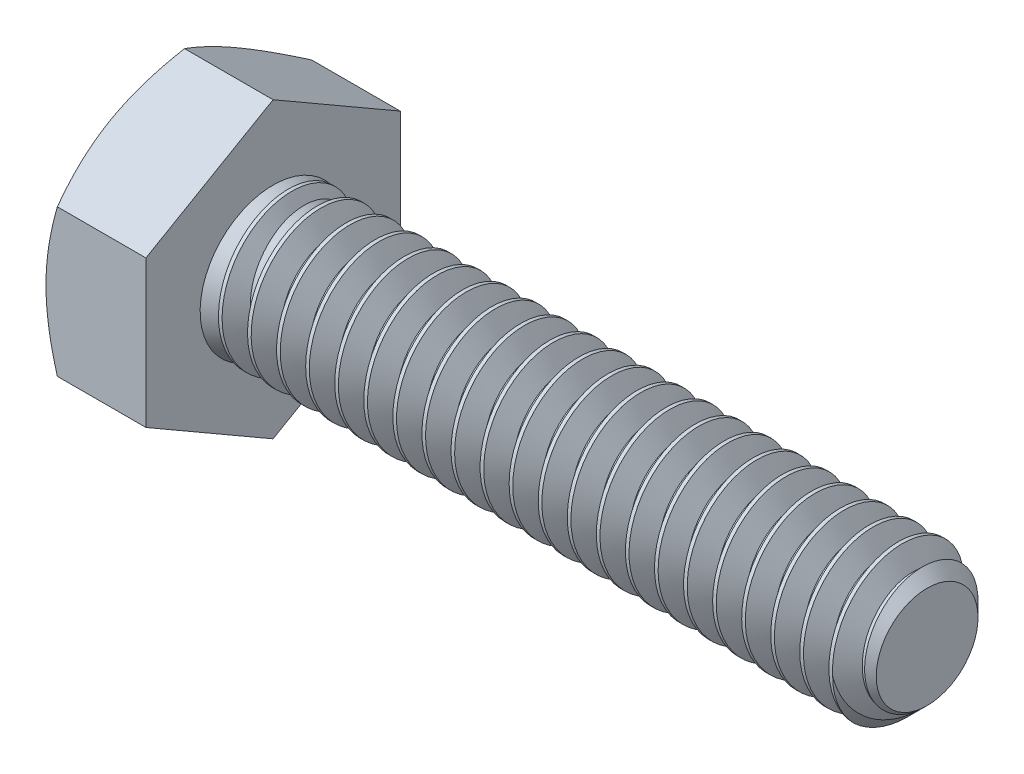
from build123d import *

# Parameters (mm, degrees)
BOSS_EXTRUDE4_DEPTH = 4.365625
SKETCH5_R           = 3.175
BOSS_EXTRUDE3_DEPTH = 28.575
SKETCH8_OUTSIDE_W   = 141.824
SKETCH8_OUTSIDE_H   = 143.544
SKETCH8_OUTSIDE_R   = 5.55625
CUT_EXTRUDE3_DEPTH  = 35.016455452
CUT_EXTRUDE3_DRAFT  = -60
CUT_EXTRUDE4_DEPTH  = 0.254
CIRPATTERN1_COUNT   = 6
CHAMFER1_SIZE       = 0.9525
CUT_SWEEP2_PITCH    = 1.27
CUT_SWEEP2_TO       = 28.575


with BuildPart() as part:
    # Sketch6 → Boss-Extrude4 (new body)
    with BuildSketch(Plane.ZY.offset(12.1046875)):
        Polygon((5.55625, 3.207902433), (0, 6.415804866), (-5.55625, 3.207902433), (-5.55625, -3.207902433), (0, -6.415804866), (5.55625, -3.207902433), align=None)
    extrude(amount=BOSS_EXTRUDE4_DEPTH)

    # Sketch5 → Boss-Extrude3 (add)
    with BuildSketch(Plane(origin=(16.4703125, 0, 0), x_dir=(0, 0, -1), z_dir=(1, 0, 0))):
        Circle(SKETCH5_R)
    extrude(amount=-BOSS_EXTRUDE3_DEPTH)


with BuildPart() as cut_extrude3_tool:
    # Sketch8 outside → Cut-Extrude3 (with draft: the straight prism first)
    with BuildSketch(Plane.ZY.offset(16.4703125)):
        Rectangle(SKETCH8_OUTSIDE_W, SKETCH8_OUTSIDE_H)
        Circle(SKETCH8_OUTSIDE_R, mode=Mode.SUBTRACT)
    extrude(amount=-CUT_EXTRUDE3_DEPTH)
    # Cut-Extrude3: the draft: its side faces are tilted about the plane it starts from
    cut_extrude3_sides = [cut_extrude3_tool.faces().sort_by_distance(p)[0] for p in [
        (1.037915226, -71.772, 0),
        (1.037915226, 0, 70.912),
        (1.037915226, 71.772, 0),
        (1.037915226, 0, -70.912),
        (1.037915226, 0, -5.55625),
    ]]
    draft(cut_extrude3_sides, Plane.ZY.offset(16.4703125), CUT_EXTRUDE3_DRAFT)


with BuildPart() as part_1:
    add(part.part)

    # Cut-Extrude3: cut by cut_extrude3_tool
    add(cut_extrude3_tool.part, mode=Mode.SUBTRACT)

    # Sketch12 → Cut-Extrude4 (cut)
    with BuildSketch(Plane.ZY.offset(16.4703125)):
        with BuildLine():
            Line((0.1666875, 4.2783125), (0.1666875, 2.3891875))
            ThreePointArc((0.1666875, 2.3891875), (0, 2.2225), (-0.1666875, 2.3891875))
            Line((-0.1666875, 2.3891875), (-0.1666875, 4.2783125))
            ThreePointArc((-0.1666875, 4.2783125), (0, 4.445), (0.1666875, 4.2783125))
        make_face()
    cut_extrude4 = extrude(amount=-CUT_EXTRUDE4_DEPTH, mode=Mode.SUBTRACT)

    # CirPattern1: Cut-Extrude4 ×6 about axis
    cirpattern1_axis = Axis((0, 0, 0), (1, 0, 0))
    for i in range(1, CIRPATTERN1_COUNT):
        add(cut_extrude4.rotate(cirpattern1_axis, i * 360 / CIRPATTERN1_COUNT), mode=Mode.SUBTRACT)

    # Chamfer1
    chamfer1_edges = [part_1.edges().sort_by_distance(p)[0] for p in [
        (16.4703125, 0, 3.175),
    ]]
    chamfer(chamfer1_edges, length=CHAMFER1_SIZE)


with BuildPart() as body_2:
    # Split1: read off the stored shape, not the designer's step
    # Split1: the piece on the far side of the plane
    add(part_1.part)
    split(bisect_by=Plane.YZ.offset(-12.1046875), keep=Keep.BOTTOM)


with BuildPart() as part_2:
    add(part_1.part)

    # Split1
    split(bisect_by=Plane.YZ.offset(-12.1046875), keep=Keep.TOP)

    # Cut-Sweep2: arcs per turn and ends read off the stored shape
    # Cut-Sweep2: the profile of Sketch10 screwed along a right-hand helix through 23.5 turns, 8 arcs to a turn; built about Z, then put on its axis
    cut_sweep2_z = Axis((0, 0, 0), (0, 0, 1))
    cut_sweep2_corners = [(3.243740766, 0, 0.0396875), (3.243740766, 0, -1.1509375), (2.350110803, 0, -0.635), (2.350110803, 0, -0.47625)]
    with BuildLine(mode=Mode.PRIVATE) as cut_sweep2_profile:
        Line(cut_sweep2_corners[0], cut_sweep2_corners[1])
        Line(cut_sweep2_corners[1], cut_sweep2_corners[2])
        Line(cut_sweep2_corners[2], cut_sweep2_corners[3])
        Line(cut_sweep2_corners[3], cut_sweep2_corners[0])
    cut_sweep2_cap = Face(cut_sweep2_profile.wire())
    cut_sweep2_turn_angles = [0, 22.5, 45, 67.5, 90, 112.5, 135, 157.5, 180, 202.5, 225, 247.5, 270, 292.5, 315, 337.5, 360]
    cut_sweep2_turn_weights = [1, 0.9238795325112867, 1, 0.9238795325112867, 1, 0.9238795325112867, 1, 0.9238795325112867, 1, 0.9238795325112867, 1, 0.9238795325112867, 1, 0.9238795325112867, 1, 0.9238795325112867, 1]
    cut_sweep2_turn_rails = [Edge.make_bspline([Vector(p[0], p[1], 0).rotate(cut_sweep2_z, cut_sweep2_turn_angles[k]) / cut_sweep2_turn_weights[k] + Vector(0, 0, p[2] + CUT_SWEEP2_PITCH * cut_sweep2_turn_angles[k] / 360) for k in range(17)], [0, 0, 0, 1, 1, 2, 2, 3, 3, 4, 4, 5, 5, 6, 6, 7, 7, 8, 8, 8], 2, cut_sweep2_turn_weights) for p in cut_sweep2_corners]
    cut_sweep2_turn_sides = [Face.make_surface_from_curves(cut_sweep2_turn_rails[p[0]], cut_sweep2_turn_rails[p[1]]) for p in [(0, 1), (1, 2), (2, 3), (3, 0)]]
    cut_sweep2_last_angles = [8280, 8302.5, 8325, 8347.5, 8370, 8392.5, 8415, 8437.5, 8460]
    cut_sweep2_last_weights = [1, 0.9238795325112867, 1, 0.9238795325112867, 1, 0.9238795325112867, 1, 0.9238795325110984, 1]
    cut_sweep2_last_rails = [Edge.make_bspline([Vector(p[0], p[1], 0).rotate(cut_sweep2_z, cut_sweep2_last_angles[k]) / cut_sweep2_last_weights[k] + Vector(0, 0, p[2] + CUT_SWEEP2_PITCH * cut_sweep2_last_angles[k] / 360) for k in range(9)], [0, 0, 0, 1, 1, 2, 2, 3, 3, 4, 4, 4], 2, cut_sweep2_last_weights) for p in cut_sweep2_corners]
    cut_sweep2_last_sides = [Face.make_surface_from_curves(cut_sweep2_last_rails[p[0]], cut_sweep2_last_rails[p[1]]) for p in [(0, 1), (1, 2), (2, 3), (3, 0)]]
    cut_sweep2 = Plane(origin=(16.4703125, 0, 0), x_dir=(0, 1, 0), z_dir=(-1, 0, 0)) * split(Solid(Shell([*[p.moved(Location((0, 0, CUT_SWEEP2_PITCH * i))) for i in range(23) for p in cut_sweep2_turn_sides], *cut_sweep2_last_sides, cut_sweep2_cap, cut_sweep2_cap.rotate(cut_sweep2_z, 8460).moved(Location((0, 0, CUT_SWEEP2_PITCH * 8460 / 360)))])), bisect_by=Plane.XY.offset(CUT_SWEEP2_TO), keep=Keep.BOTTOM, mode=Mode.PRIVATE)
    add(cut_sweep2, mode=Mode.SUBTRACT)

    add(body_2.part)  # Revolve7 merges body 2
    # Sketch13 → Revolve7 (revolve)
    with BuildSketch(Plane.XY, mode=Mode.PRIVATE) as revolve7_sk:
        Polygon((-12.3586875, 0), (-6.583429141, 0), (-12.1046875, 3.1877), (-12.3586875, 3.1877), align=None)
    revolve(revolve7_sk.sketch.rotate(Axis((-12.3586875, 0, 0), (1, 0, 0)), 180), axis=Axis((-12.3586875, 0, 0), (1, 0, 0)))


solid = part_2.part
